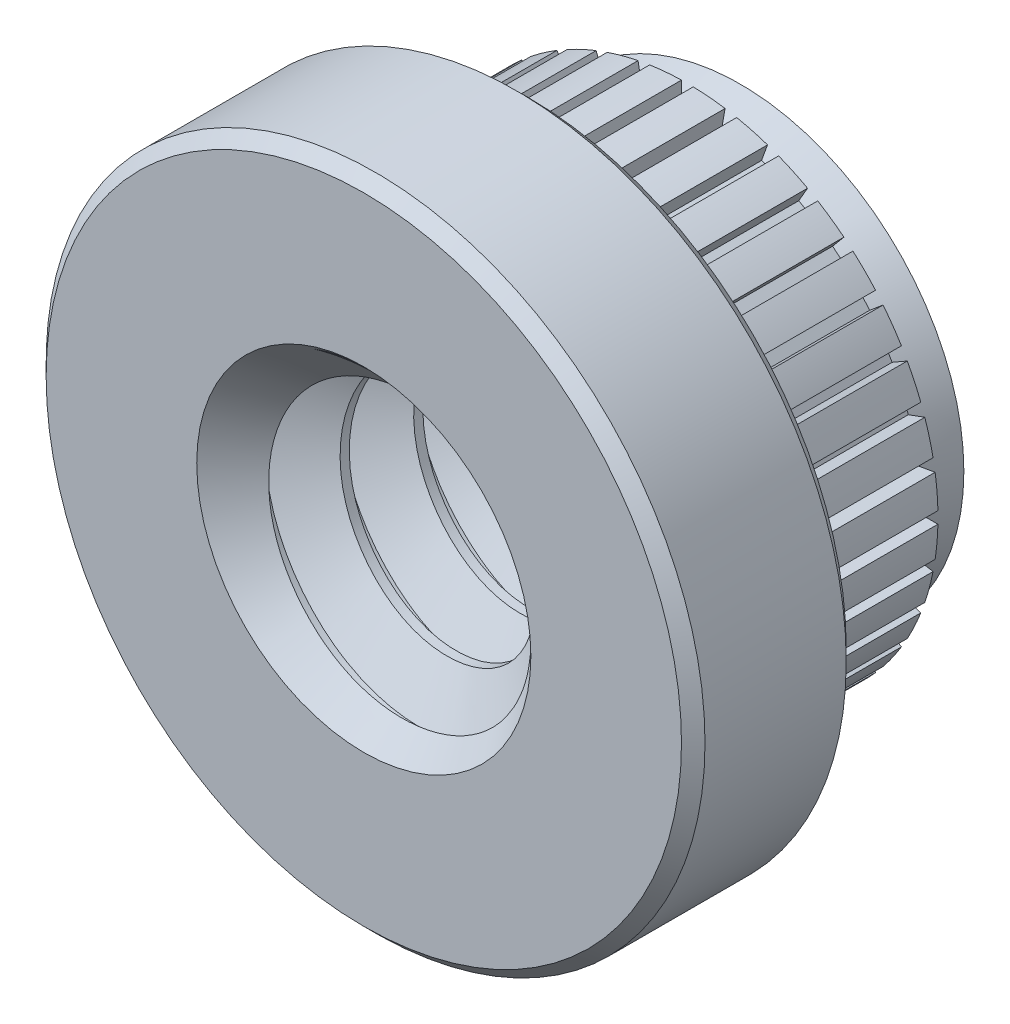
from build123d import *

# Parameters (mm, degrees)
SKETCH1_R               = 3.556
EXTRUDE1_DEPTH          = 1.778
SKETCH2_R               = 2.7051
EXTRUDE2_DEPTH          = 2.286
SKETCH3_W               = 0.127
SKETCH3_H               = 1.0414
CUT_EXTRUDE_THIN1_DEPTH = 2.286
CIRPATTERN1_COUNT       = 36
SKETCH5_OUTSIDE_W       = 11.698
SKETCH5_OUTSIDE_H       = 11.698
SKETCH5_OUTSIDE_R       = 2.413
CUT_EXTRUDE1_DEPTH      = 0.5715
CUT_EXTRUDE1_DRAFT      = 20
CHAMFER2_SIZE           = 0.127
SKETCH7_R               = 1.7526
CUT_EXTRUDE3_DEPTH      = 7.465784407
SWEEP1_PITCH            = 0.79375
SKETCH10_R              = 3.556
CUT_EXTRUDE4_DEPTH      = 7.923549743
SKETCH11_R              = 2.413
CUT_EXTRUDE5_DEPTH      = 7.46578447


with BuildPart() as part:
    # Sketch1 → Extrude1 (new body)
    with BuildSketch(Plane.XY):
        Circle(SKETCH1_R)
    extrude(amount=-EXTRUDE1_DEPTH)

    # Sketch2 → Extrude2 (add)
    with BuildSketch(Plane(origin=(0, 0, -1.778), x_dir=(-1, 0, 0), z_dir=(0, 0, -1))):
        with Locations(Location((0, 0, 0), (0, 0, 180))):
            Circle(SKETCH2_R)
    extrude(amount=EXTRUDE2_DEPTH)

    # Sketch3 → Cut-Extrude-Thin1 (cut)
    with BuildSketch(Plane(origin=(0, 0, -4.064), x_dir=(-1, 0, 0), z_dir=(0, 0, -1))):
        with Locations((0, 3.0353)):
            Rectangle(SKETCH3_W, SKETCH3_H)
    cut_extrude_thin1 = extrude(amount=-CUT_EXTRUDE_THIN1_DEPTH, mode=Mode.SUBTRACT)

    # CirPattern1: Cut-Extrude-Thin1 ×36 about axis
    cirpattern1_axis = Axis((0, 0, 0), (0, 0, 1))
    for i in range(1, CIRPATTERN1_COUNT):
        add(cut_extrude_thin1.rotate(cirpattern1_axis, i * 360 / CIRPATTERN1_COUNT), mode=Mode.SUBTRACT)


with BuildPart() as cut_extrude1_tool:
    # Sketch5 outside → Cut-Extrude1 (with draft: the straight prism first)
    with BuildSketch(Plane(origin=(0, 0, -4.064), x_dir=(-1, 0, 0), z_dir=(0, 0, -1))):
        Rectangle(SKETCH5_OUTSIDE_W, SKETCH5_OUTSIDE_H)
        Circle(SKETCH5_OUTSIDE_R, mode=Mode.SUBTRACT)
    extrude(amount=-CUT_EXTRUDE1_DEPTH)
    # Cut-Extrude1: the draft: its side faces are tilted about the plane it starts from
    cut_extrude1_sides = [cut_extrude1_tool.faces().sort_by_distance(p)[0] for p in [
        (0, -5.849, -3.77825),
        (-5.849, 0, -3.77825),
        (0, 5.849, -3.77825),
        (5.849, 0, -3.77825),
        (2.413, 0, -3.77825),
    ]]
    draft(cut_extrude1_sides, Plane(origin=(0, 0, -4.064), x_dir=(-1, 0, 0), z_dir=(0, 0, -1)), CUT_EXTRUDE1_DRAFT)


with BuildPart() as part_1:
    add(part.part)

    # Cut-Extrude1: cut by cut_extrude1_tool
    add(cut_extrude1_tool.part, mode=Mode.SUBTRACT)

    # Chamfer2
    chamfer2_edges = [part_1.edges().sort_by_distance(p)[0] for p in [
        (-3.556, 0, 0),
        (-3.556, 0, -1.778),
    ]]
    chamfer(chamfer2_edges, length=CHAMFER2_SIZE)

    # Sketch7 → Cut-Extrude3 (cut, through all)
    with BuildSketch(Plane.XY):
        Circle(SKETCH7_R)
    extrude(amount=-CUT_EXTRUDE3_DEPTH, mode=Mode.SUBTRACT)

    # Sweep1: the profile of Sketch9 profile screwed along a right-hand helix of 9.12 turns, 6 arcs to a turn; built about Z, then put on its axis
    sweep1_z = Axis((0, 0, 0), (0, 0, 1))
    sweep1_corners = [(1.7529, 0, -0.694704455), (1.237044252, 0, -0.396875), (1.237044252, 0, -0.29765625), (1.7529, 0, 0.000173205)]
    with BuildLine(mode=Mode.PRIVATE) as sweep1_profile:
        Line(sweep1_corners[0], sweep1_corners[1])
        Line(sweep1_corners[1], sweep1_corners[2])
        Line(sweep1_corners[2], sweep1_corners[3])
        Line(sweep1_corners[3], sweep1_corners[0])
    sweep1_cap = Face(sweep1_profile.wire())
    sweep1_turn_angles = [0, 30, 60, 90, 120, 150, 180, 210, 240, 270, 300, 330, 360]
    sweep1_turn_weights = [1, 0.8660254037844387, 1, 0.8660254037844387, 1, 0.8660254037844387, 1, 0.8660254037844387, 1, 0.8660254037844387, 1, 0.8660254037844387, 1]
    sweep1_turn_rails = [Edge.make_bspline([Vector(p[0], p[1], 0).rotate(sweep1_z, sweep1_turn_angles[k]) / sweep1_turn_weights[k] + Vector(0, 0, p[2] + SWEEP1_PITCH * sweep1_turn_angles[k] / 360) for k in range(13)], [0, 0, 0, 1, 1, 2, 2, 3, 3, 4, 4, 5, 5, 6, 6, 6], 2, sweep1_turn_weights) for p in sweep1_corners]
    sweep1_turn_sides = [Face.make_surface_from_curves(sweep1_turn_rails[p[0]], sweep1_turn_rails[p[1]]) for p in [(0, 1), (1, 2), (2, 3), (3, 0)]]
    sweep1_last_angles = [3240, 3261.6, 3283.2]
    sweep1_last_weights = [1, 0.9297764858881702, 1]
    sweep1_last_rails = [Edge.make_bspline([Vector(p[0], p[1], 0).rotate(sweep1_z, sweep1_last_angles[k]) / sweep1_last_weights[k] + Vector(0, 0, p[2] + SWEEP1_PITCH * sweep1_last_angles[k] / 360) for k in range(3)], [0, 0, 0, 1, 1, 1], 2, sweep1_last_weights) for p in sweep1_corners]
    sweep1_last_sides = [Face.make_surface_from_curves(sweep1_last_rails[p[0]], sweep1_last_rails[p[1]]) for p in [(0, 1), (1, 2), (2, 3), (3, 0)]]
    sweep1 = Plane(origin=(0, 0, -4.064), x_dir=(0, 1, 0), z_dir=(0, 0, 1)) * Solid(Shell([*[p.moved(Location((0, 0, SWEEP1_PITCH * i))) for i in range(9) for p in sweep1_turn_sides], *sweep1_last_sides, sweep1_cap, sweep1_cap.rotate(sweep1_z, 3283.2).moved(Location((0, 0, SWEEP1_PITCH * 3283.2 / 360)))]))
    add(sweep1)

    # Sketch10 → Cut-Extrude4 (cut, through all)
    with BuildSketch(Plane.XY):
        Circle(SKETCH10_R)
    extrude(amount=CUT_EXTRUDE4_DEPTH, mode=Mode.SUBTRACT)

    # Sketch11 → Cut-Extrude5 (cut, through all)
    with BuildSketch(Plane(origin=(0, 0, -4.064), x_dir=(-1, 0, 0), z_dir=(0, 0, -1))):
        Circle(SKETCH11_R)
    extrude(amount=CUT_EXTRUDE5_DEPTH, mode=Mode.SUBTRACT)

    # Cut-Extrude6 cone 1 section (through the dimple's axis) → Cut-Extrude6 (revolve, cut)
    with BuildSketch(Plane(origin=(0, 0, 0), x_dir=(0, -1, 0), z_dir=(1, 0, 0))):
        Polygon((0, 0), (1.8034, 0), (0, 1.8034), align=None)
    revolve(axis=Axis((0, 0, 0), (0, 0, -1)), mode=Mode.SUBTRACT)

    # Cut-Extrude7 cone 1 section (through the dimple's axis) → Cut-Extrude7 (revolve, cut)
    with BuildSketch(Plane(origin=(0, 0, -4.064), x_dir=(0, 1, 0), z_dir=(1, 0, 0))):
        Polygon((0, 0), (1.8034, 0), (0, 1.8034), align=None)
    revolve(axis=Axis((0, 0, -4.064), (0, 0, 1)), mode=Mode.SUBTRACT)


solid = part_1.part
